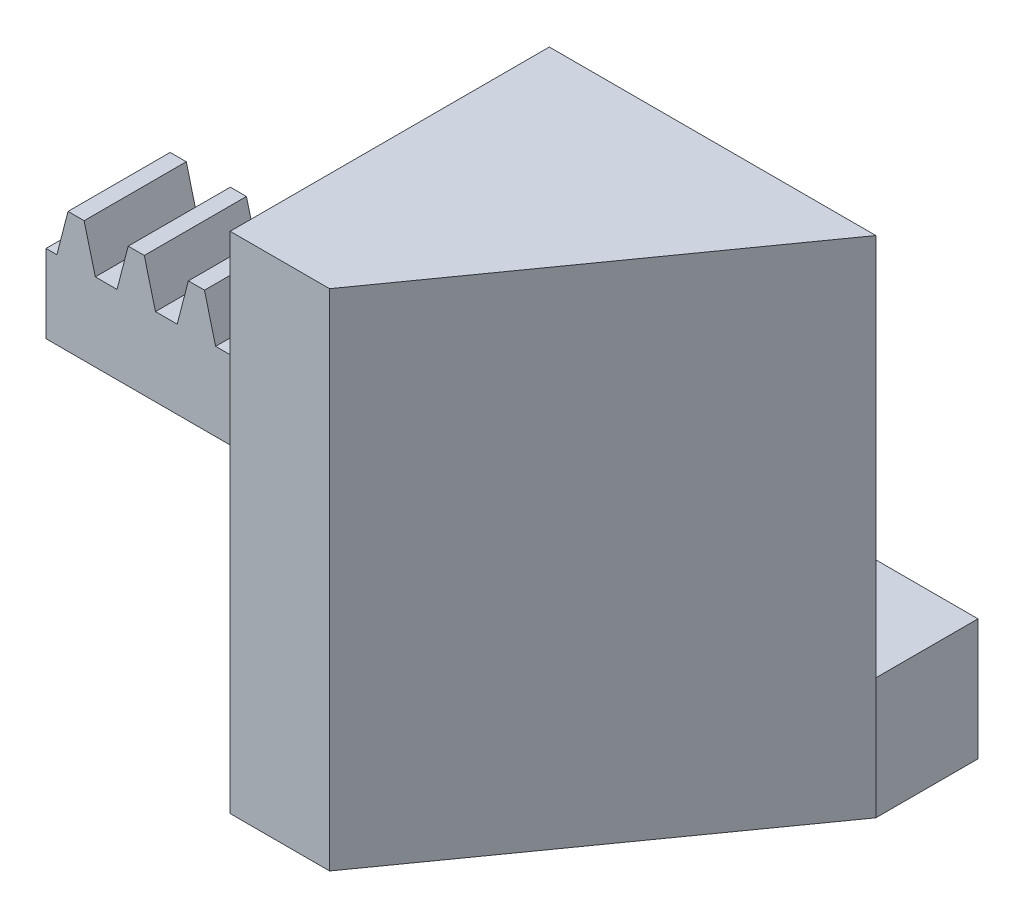
from build123d import *

# Parameters (mm, degrees)
BLANKSKE_W          = 50
BLANKSKE_H          = 9.5
BLANK_DEPTH         = 8
TOOTHCUTSIM_DEPTH   = 52.519413817
TEETHCUTS_COUNT     = 12
TEETHCUTS_PITCH     = 4.712388975
SKETCH3_W           = 8
SKETCH3_H           = 9.5
BOSS_EXTRUDE2_DEPTH = 15
BOSS_EXTRUDE5_DEPTH = 39.5


with BuildPart() as part:
    # BlankSke → Blank (new body)
    with BuildSketch(Plane.XY):
        with Locations((25, 4.75)):
            Rectangle(BLANKSKE_W, BLANKSKE_H)
    extrude(amount=-BLANK_DEPTH)

    # TooCutSkeSim → ToothCutSim (cut, through all)
    with BuildSketch(Plane.XY):
        Polygon((0.852189273, 6.125), (-0.852189273, 6.125), (-1.731592507, 9.5254), (1.731592507, 9.5254), align=None)
    toothcutsim = extrude(amount=-TOOTHCUTSIM_DEPTH, mode=Mode.SUBTRACT)

    # TeethCuts: ToothCutSim ×12
    with Locations(*[(i * TEETHCUTS_PITCH, 0, 0) for i in range(1, TEETHCUTS_COUNT)]):
        add(toothcutsim, mode=Mode.SUBTRACT)

    # Sketch3 → Boss-Extrude2 (add)
    with BuildSketch(Plane(origin=(50, 0, 0), x_dir=(0, 0, -1), z_dir=(1, 0, 0))):
        with Locations((4, 4.75)):
            Rectangle(SKETCH3_W, SKETCH3_H)
    extrude(amount=BOSS_EXTRUDE2_DEPTH)

    # Sketch7 → Boss-Extrude5 (add)
    with BuildSketch(Plane(origin=(0, 0, 0), x_dir=(1, 0, 0), z_dir=(0, 1, 0))):
        Polygon((65, 0), (39.42413542, 0), (39.42413542, -25), (47.21206771, -25), align=None)
    extrude(amount=BOSS_EXTRUDE5_DEPTH)


solid = part.part
